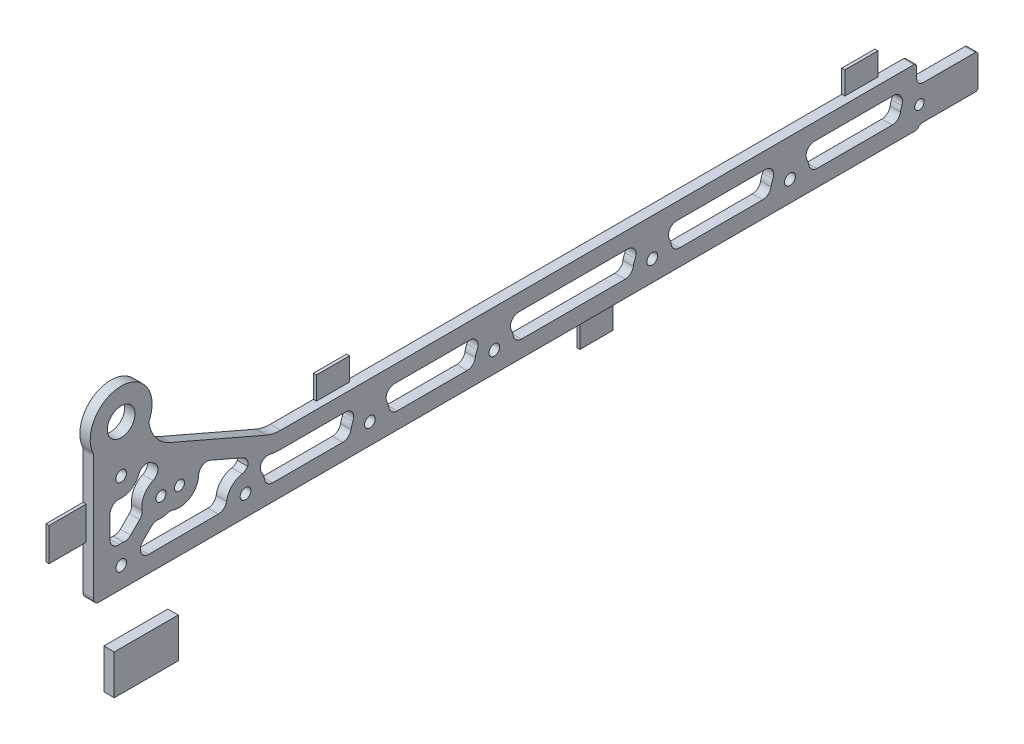
from build123d import *

# Parameters (mm, degrees)
SKETCH1_R                    = 6.35
BASE_FLANGE1_DEPTH           = 4.7625
SKETCH13_R                   = 2.286
CUT_EXTRUDE1_DEPTH           = 177.861362293
FILLET1_R                    = 16.51
F_10_0_1935_DIAMETER_HOLE1_D = 4.9149
FILLET4_R                    = 2.54
SKETCH37_R                   = 2.4892
SKETCH37_R_2                 = 2.159
BOSS_EXTRUDE8_DEPTH          = 4.7625
CUT_EXTRUDE4_DEPTH           = 385.869414133
FILLET10_R                   = 3.81
FILLET9_R                    = 1.27
SKETCH41_W                   = 15.24
SKETCH41_H                   = 10.426795597
SKETCH41_H_2                 = 13.305594342
SKETCH41_W_2                 = 17.065899381
SKETCH41_H_3                 = 15.24
BOSS_EXTRUDE9_DEPTH          = 1.397
SKETCH43_W                   = 29.412180093
SKETCH43_H                   = 18.266511847
BOSS_EXTRUDE10_DEPTH         = 4.7625


# Sheet-metal steps are written as plain solids
with BuildPart() as part:
    # Sketch1 → Base-Flange1 (new body)
    with BuildSketch(Plane(origin=(0, 0, 0), x_dir=(0, 0, -1), z_dir=(1, 0, 0))):
        with BuildLine():
            Line((0, 24.765), (57.15, 0))
            Line((57.15, 0), (168.275, 0))
            Line((168.275, 0), (168.275, -26.67))
            Line((168.275, -26.67), (-25.4, -26.67))
            Line((-25.4, -26.67), (-25.4, 24.765))
            Line((-25.4, 24.765), (-25.4, 33.599363732))
            ThreePointArc((-25.4, 33.599363732), (-12.7, 54.229), (0, 33.599363732))
            Line((0, 33.599363732), (0, 24.765))
        make_face()
        with Locations((-12.7, 40.005)):
            Circle(SKETCH1_R, mode=Mode.SUBTRACT)
    extrude(amount=-BASE_FLANGE1_DEPTH)

    # Sketch13 → Cut-Extrude1 (cut, through all)
    with BuildSketch(Plane(origin=(0, 0, 0), x_dir=(0, 0, -1), z_dir=(1, 0, 0))):
        with Locations((5.599088111, 1.280695695)):
            Circle(SKETCH13_R)
        with Locations((14.108088111, 1.280695695)):
            Circle(SKETCH13_R)
    extrude(amount=-CUT_EXTRUDE1_DEPTH, mode=Mode.SUBTRACT)

    # Fillet1
    # the kernel refuses this fillet: 16.51 mm, written as the material it adds along each edge
    with BuildSketch(Plane(origin=(0, 0, -57.15), x_dir=(0, 0.3976074376343002, 0.9175556253099242), z_dir=(-1, 0, 0))) as fillet1_piece_1:
        with BuildLine():
            CenterArc((FILLET1_R * 0.20735118835, FILLET1_R), FILLET1_R, 246.571307191, 23.428692809)
            Line((-FILLET1_R * 0.190256249285, FILLET1_R * 0.0824443746901), (-FILLET1_R * 0.198208398037, FILLET1_R * 0.0640932621839))
            Line((-FILLET1_R * 0.198208398037, FILLET1_R * 0.0640932621839), (-FILLET1_R * 0.00414702376699, -FILLET1_R * 0.02))
            Line((-FILLET1_R * 0.00414702376699, -FILLET1_R * 0.02), (FILLET1_R * 0.20735118835, -FILLET1_R * 0.02))
            Line((FILLET1_R * 0.20735118835, -FILLET1_R * 0.02), (FILLET1_R * 0.20735118835, 0))
        make_face()
    extrude(amount=4.7625)
    with BuildSketch(Plane(origin=(0, 24.765, 0), x_dir=(0, 1, 0), z_dir=(-1, 0, 0))) as fillet1_piece_2:
        with BuildLine():
            CenterArc((10.895073619, 16.380890536), FILLET1_R, 203.428692809, 59.401184998)
            Line((-4.253769754, 9.816391741), (-4.556746622, 9.685101765))
            Line((-4.556746622, 9.685101765), (-0.302976867, -0.131289976))
            Line((-0.302976867, -0.131289976), (0, -0.3302))
            ThreePointArc((0, -0.3302), (4.417181866, -0.3302), (8.793149534, -0.327617811))
            Line((8.793149534, -0.327617811), (8.834363732, 0))
        make_face()
    extrude(amount=4.7625)

    # #10 (0.1935) Diameter Hole1 (through all)
    with Locations(Plane(origin=(0, 0, 0), x_dir=(0, 0, -1), z_dir=(1, 0, 0))):
        with Locations((-12.7, -17.145), (44.45, -17.145), (101.6, -17.145), (158.75, -17.145), (-12.7, 18.415)):
            Hole(F_10_0_1935_DIAMETER_HOLE1_D / 2)

    # Fillet4
    fillet4_edges = [part.edges().sort_by_distance(p)[0] for p in [
        (-2.38125, -26.67, 25.4),
        (-2.38125, 33.599363732, 25.4),
        (-2.38125, 33.599363732, 0),
        (-2.38125, 0, -168.275),
        (-2.38125, -26.67, -168.275),
    ]]
    fillet(fillet4_edges, radius=FILLET4_R)

    # Sketch37 → Boss-Extrude8 (add, through all)
    with BuildSketch(Plane.ZY.offset(4.7625)):
        with BuildLine():
            Line((-165.735, -26.67), (-353.050492793, -26.67))
            ThreePointArc((-353.050492793, -26.67), (-354.081300886, -25.467794465), (-355.6, -25.019))
            Line((-355.6, -25.019), (-381, -25.019))
            Line((-381, -25.019), (-381, -9.271))
            Line((-381, -9.271), (-355.6, -9.271))
            ThreePointArc((-355.6, -9.271), (-353.624343653, -8.452656347), (-352.806, -6.477))
            Line((-352.806, -6.477), (-352.806, 0))
            Line((-352.806, 0), (-165.735, 0))
            ThreePointArc((-165.735, 0), (-167.531051224, -0.743948776), (-168.275, -2.54))
            Line((-168.275, -2.54), (-168.275, -24.13))
            ThreePointArc((-168.275, -24.13), (-167.531051224, -25.926051224), (-165.735, -26.67))
        make_face()
        with Locations((-231.3432, -17.145)):
            Circle(SKETCH37_R, mode=Mode.SUBTRACT)
        with Locations((-294.5892, -17.145)):
            Circle(SKETCH37_R, mode=Mode.SUBTRACT)
        with Locations((-354.076, -17.145)):
            Circle(SKETCH37_R_2, mode=Mode.SUBTRACT)
    extrude(amount=-BOSS_EXTRUDE8_DEPTH)

    # Sketch46 → Cut-Extrude4 (cut, through all)
    with BuildSketch(Plane(origin=(0, 0, 0), x_dir=(0, 0, -1), z_dir=(1, 0, 0))):
        with BuildLine():
            Line((2.706888413, -7.038340091), (-2.772090448, -12.555226867))
            ThreePointArc((-2.772090448, -12.555226867), (-3.586204482, -16.704089198), (-0.068741928, -19.05))
            Line((-0.068741928, -19.05), (35.851037824, -19.05))
            ThreePointArc((35.851037824, -19.05), (37.693572505, -11.495056371), (44.803210666, -8.344635364))
            Line((44.803210666, -8.344635364), (46.769714385, -3.806549857))
            Line((46.769714385, -3.806549857), (28.228490299, 4.22798058))
            ThreePointArc((28.228490299, 4.22798058), (24.692377449, 3.961758537), (22.907209027, 0.897751035))
            ThreePointArc((22.907209027, 0.897751035), (18.419825524, -6.399154303), (9.853588111, -6.431010034))
            ThreePointArc((9.853588111, -6.431010034), (6.34486152, -7.495123214), (2.706888413, -7.038340091))
        make_face()
        with BuildLine():
            ThreePointArc((-17.78, -9.95022582), (-13.929881531, -8.423843716), (-9.807800302, -8.825964214))
            Line((-9.807800302, -8.825964214), (-2.699808628, -1.668793824))
            ThreePointArc((-2.699808628, -1.668793824), (-2.509818664, 4.718253902), (1.948387063, 9.295903575))
            ThreePointArc((1.948387063, 9.295903575), (4.163222782, 12.415325762), (2.552557444, 15.885491351))
            ThreePointArc((2.552557444, 15.885491351), (1.967041619, 16.308126446), (1.39443434, 16.748092478))
            ThreePointArc((1.39443434, 16.748092478), (-1.956838768, 17.442464838), (-4.513313275, 15.167025867))
            ThreePointArc((-4.513313275, 15.167025867), (-10.188589389, 9.973199703), (-17.78, 11.22022582))
            Line((-17.78, 11.22022582), (-17.78, -9.95022582))
        make_face()
        with BuildLine():
            ThreePointArc((50.629688886, -10.869442593), (52.895857664, -14.647268264), (53.048962176, -19.05))
            Line((53.048962176, -19.05), (93.001037824, -19.05))
            ThreePointArc((93.001037824, -19.05), (92.862397499, -16.037986881), (93.747815722, -13.155717162))
            ThreePointArc((93.747815722, -13.155717162), (93.59844242, -9.437373892), (90.351052516, -7.62))
            Line((90.351052516, -7.62), (60.57336812, -7.62))
            ThreePointArc((60.57336812, -7.62), (56.540885431, -7.280670091), (52.621816914, -6.272224067))
            Line((52.621816914, -6.272224067), (50.629688886, -10.869442593))
        make_face()
        with BuildLine():
            ThreePointArc((109.452184278, -13.155717162), (110.337602501, -16.037986881), (110.198962176, -19.05))
            Line((110.198962176, -19.05), (150.151037824, -19.05))
            ThreePointArc((150.151037824, -19.05), (150.012397499, -16.037986881), (150.897815722, -13.155717162))
            ThreePointArc((150.897815722, -13.155717162), (150.74844242, -9.437373892), (147.501052516, -7.62))
            Line((147.501052516, -7.62), (112.848947484, -7.62))
            ThreePointArc((112.848947484, -7.62), (109.60155758, -9.437373892), (109.452184278, -13.155717162))
        make_face()
        with BuildLine():
            ThreePointArc((166.602184278, -13.155717162), (167.487602501, -16.037986881), (167.348962176, -19.05))
            Line((167.348962176, -19.05), (222.744237824, -19.05))
            ThreePointArc((222.744237824, -19.05), (222.605597499, -16.037986881), (223.491015722, -13.155717162))
            ThreePointArc((223.491015722, -13.155717162), (223.34164242, -9.437373892), (220.094252516, -7.62))
            Line((220.094252516, -7.62), (169.998947484, -7.62))
            ThreePointArc((169.998947484, -7.62), (166.75155758, -9.437373892), (166.602184278, -13.155717162))
        make_face()
        with BuildLine():
            ThreePointArc((239.195384278, -13.155717162), (240.080802501, -16.037986881), (239.942162176, -19.05))
            Line((239.942162176, -19.05), (285.990237824, -19.05))
            ThreePointArc((285.990237824, -19.05), (285.851597499, -16.037986881), (286.737015722, -13.155717162))
            ThreePointArc((286.737015722, -13.155717162), (286.58764242, -9.437373892), (283.340252516, -7.62))
            Line((283.340252516, -7.62), (242.592147484, -7.62))
            ThreePointArc((242.592147484, -7.62), (239.34475758, -9.437373892), (239.195384278, -13.155717162))
        make_face()
        with BuildLine():
            ThreePointArc((302.441384278, -13.155717162), (303.326802501, -16.037986881), (303.188162176, -19.05))
            Line((303.188162176, -19.05), (345.477037824, -19.05))
            ThreePointArc((345.477037824, -19.05), (345.435156695, -15.440006602), (346.845143193, -12.116492733))
            ThreePointArc((346.845143193, -12.116492733), (345.786037574, -9.960896884), (345.248915661, -7.62))
            Line((345.248915661, -7.62), (305.838147484, -7.62))
            ThreePointArc((305.838147484, -7.62), (302.59075758, -9.437373892), (302.441384278, -13.155717162))
        make_face()
    extrude(amount=-CUT_EXTRUDE4_DEPTH, mode=Mode.SUBTRACT)

    # Fillet10
    # the kernel refuses this fillet: 3.81 mm, written as the material it adds along each edge
    with BuildSketch(Plane(origin=(0, -12.116492733, -346.845143193), x_dir=(0, -0.8724157215172805, 0.4887645740532785), z_dir=(-1, 0, 0))) as fillet10_piece_1:
        with BuildLine():
            CenterArc((2.074419241, 3.792099223), FILLET10_R, 217.573998525, 46.86975803)
            ThreePointArc((-0.945258943, 1.468816274), (-0.441780403, 0.754261102), (0, 0))
            ThreePointArc((0, 0), (0.852762148, 0.041380629), (1.705524296, 0))
        make_face()
    extrude(amount=4.7625)
    with BuildSketch(Plane(origin=(0, -19.05, -345.477037824), x_dir=(0, 0, 1), z_dir=(-1, 0, 0)), Plane(origin=(0, -19.05, -285.990237824), x_dir=(0, 0, 1), z_dir=(-1, 0, 0)), Plane(origin=(0, -19.05, -222.744237824), x_dir=(0, 0, 1), z_dir=(-1, 0, 0)), Plane(origin=(0, -19.05, -150.151037824), x_dir=(0, 0, 1), z_dir=(-1, 0, 0)), Plane(origin=(0, -19.05, -93.001037824), x_dir=(0, 0, 1), z_dir=(-1, 0, 0)), Plane(origin=(0, -19.05, -35.851037824), x_dir=(0, 0, 1), z_dir=(-1, 0, 0))) as fillet10_piece_2:
        with BuildLine():
            CenterArc((3.873849035, 3.81), FILLET10_R, 188.683803177, 81.316196823)
            ThreePointArc((0.107524563, 3.234760946), (0.203626087, 1.612398949), (0, 0))
            Line((0, 0), (3.873849035, 0))
        make_face()
    extrude(amount=4.7625)
    with BuildSketch(Plane(origin=(0, -19.05, -303.188162176), x_dir=(0, 0.9994479972032501, -0.033221994016196514), z_dir=(-1, 0, 0)), Plane(origin=(0, -19.05, -239.942162176), x_dir=(0, 0.9994479972032498, -0.033221994016205396), z_dir=(-1, 0, 0)), Plane(origin=(0, -19.05, -167.348962176), x_dir=(0, 0.9994479972032501, -0.033221994016196514), z_dir=(-1, 0, 0)), Plane(origin=(0, -19.05, -110.198962176), x_dir=(0, 0.99944799720325, -0.033221994016201024), z_dir=(-1, 0, 0)), Plane(origin=(0, -19.05, -53.048962176), x_dir=(0, 0.99944799720325, -0.033221994016200955), z_dir=(-1, 0, 0))) as fillet10_piece_3:
        with BuildLine():
            CenterArc((3.936593859, 3.745134862), FILLET10_R, 178.096169636, 81.316196823)
            Line((0.128696989, 3.871710659), (0, 0))
            ThreePointArc((0, 0), (1.618273765, 0.149946577), (3.236547529, 0))
        make_face()
    extrude(amount=4.7625)
    with BuildSketch(Plane(origin=(0, -10.869442593, -50.629688886), x_dir=(0, 0.9175556253099386, -0.39760743763426715), z_dir=(-1, 0, 0))) as fillet10_piece_4:
        with BuildLine():
            CenterArc((2.292344432, 3.81), FILLET10_R, 213.614229501, 56.385770499)
            ThreePointArc((-0.880561767, 1.700790136), (-0.393912819, 0.874401525), (0, 0))
            Line((0, 0), (2.292344432, 0))
        make_face()
    extrude(amount=4.7625)
    with BuildSketch(Plane(origin=(0, -6.272224067, -52.621816914), x_dir=(0, -0.9175556253098971, 0.39760743763436274), z_dir=(-1, 0, 0))) as fillet10_piece_5:
        with BuildLine():
            CenterArc((3.313125115, -3.81), FILLET10_R, 90, 78.495707646)
            ThreePointArc((-0.420331094, -3.050128473), (-0.161466919, -1.531775281), (0, 0))
            Line((0, 0), (3.313125115, 0))
        make_face()
    extrude(amount=4.7625)
    with BuildSketch(Plane(origin=(0, -7.038340091, -2.706888413), x_dir=(0, -0.2319300264876581, -0.9727324723753361), z_dir=(-1, 0, 0)), Plane(origin=(0, -8.825964214, 9.807800302), x_dir=(0, 0.2319300264876563, 0.9727324723753366), z_dir=(-1, 0, 0))) as fillet10_piece_6:
        with BuildLine():
            CenterArc((2.150170588, 3.790764614), FILLET10_R, 211.391748162, 52.848437611)
            Line((-1.102143806, 1.806186301), (0, 0))
            ThreePointArc((0, 0), (0.883902373, 0.0444658), (1.767804746, 0))
        make_face()
    extrude(amount=4.7625)
    with BuildSketch(Plane(origin=(0, -6.431010034, -9.853588111), x_dir=(0, -0.41144372990401606, 0.91143516342232), z_dir=(-1, 0, 0))) as fillet10_piece_7:
        with BuildLine():
            CenterArc((1.714410244, -3.79778246), FILLET10_R, 94.589687826, 39.411744292)
            ThreePointArc((-0.932306651, -1.057163975), (-0.444970924, -0.547262622), (0, 0))
            ThreePointArc((0, 0), (0.704767934, -0.02824288), (1.409535867, 0))
        make_face()
    extrude(amount=4.7625)
    with BuildSketch(Plane(origin=(0, -3.806549857, -46.769714385), x_dir=(0, -0.9175556253099236, 0.39760743763430156), z_dir=(-1, 0, 0))) as fillet10_piece_8:
        with BuildLine():
            CenterArc((FILLET10_R, FILLET10_R), FILLET10_R, 180, 90)
            Line((0, FILLET10_R), (0, 0))
            Line((0, 0), (FILLET10_R, 0))
        make_face()
    extrude(amount=4.7625)
    with BuildSketch(Plane(origin=(0, -8.344635364, -44.803210666), x_dir=(0, -0.06877405364112607, 0.997632261680509), z_dir=(-1, 0, 0))) as fillet10_piece_9:
        with BuildLine():
            CenterArc((2.329473589, 3.78741281), FILLET10_R, 207.372268766, 56.385770499)
            Line((-1.053951262, 2.035689007), (0, 0))
            ThreePointArc((0, 0), (0.957611105, 0.052214054), (1.91522221, 0))
        make_face()
    extrude(amount=4.7625)
    with BuildSketch(Plane(origin=(0, -1.668793824, 2.699808628), x_dir=(0, -0.7095402940325821, 0.7046648644172324), z_dir=(-1, 0, 0))) as fillet10_piece_10:
        with BuildLine():
            CenterArc((2.115899317, 3.81), FILLET10_R, 217.151562389, 52.848437611)
            ThreePointArc((-0.920825974, 1.509043785), (-0.422455832, 0.777683536), (0, 0))
            Line((0, 0), (2.115899317, 0))
        make_face()
    extrude(amount=4.7625)
    with BuildSketch(Plane(origin=(0, -9.95022582, 17.78), x_dir=(0, 1, 0), z_dir=(-1, 0, 0))) as fillet10_piece_11:
        with BuildLine():
            CenterArc((5.358597658, 3.81), FILLET10_R, 174.223153513, 95.776846487)
            ThreePointArc((1.567946876, 4.193492703), (1.054877862, 1.99545519), (0, 0))
            Line((0, 0), (5.358597658, 0))
        make_face()
    extrude(amount=4.7625)
    with BuildSketch(Plane(origin=(0, 11.22022582, 17.78), x_dir=(0, -1, 0), z_dir=(-1, 0, 0))) as fillet10_piece_12:
        with BuildLine():
            CenterArc((5.358597658, -3.81), FILLET10_R, 90, 95.776846487)
            ThreePointArc((1.567946876, -4.193492703), (1.054877862, -1.99545519), (0, 0))
            Line((0, 0), (5.358597658, 0))
        make_face()
    extrude(amount=4.7625)
    with BuildSketch(Plane(origin=(0, -7.62, -345.248915661), x_dir=(0, -0.9730192637760864, -0.23072388762467294), z_dir=(-1, 0, 0))) as fillet10_piece_13:
        with BuildLine():
            CenterArc((3.019021852, 3.781288488), FILLET10_R, 193.339693773, 69.621868313)
            Line((-0.688181543, 2.902230476), (0, 0))
            ThreePointArc((0, 0), (1.276081401, 0.078478133), (2.552162803, 0))
        make_face()
    extrude(amount=4.7625)

    # Fillet9
    fillet9_edges = [part.edges().sort_by_distance(p)[0] for p in [
        (-2.38125, -26.67, -353.050492793),
        (-2.38125, -25.019, -381),
        (-2.38125, -9.271, -381),
        (-2.38125, 0, -352.806),
    ]]
    fillet(fillet9_edges, radius=FILLET9_R)

    # Sketch41 → Boss-Extrude9 (add)
    with BuildSketch(Plane.ZY.offset(4.7625)):
        with Locations((-330.765295605, 5.213397798)):
            Rectangle(SKETCH41_W, SKETCH41_H)
        with Locations((-209.083786165, -33.322797171)):
            Rectangle(SKETCH41_W, SKETCH41_H_2)
        with Locations((-87.998754713, 5.213397798)):
            Rectangle(SKETCH41_W, SKETCH41_H)
        with Locations((33.932949691, 4.327801886)):
            Rectangle(SKETCH41_W_2, SKETCH41_H_3)
    extrude(amount=-BOSS_EXTRUDE9_DEPTH)


with BuildPart() as body_2:
    # Sketch43 → Boss-Extrude10 (new, through all)
    with BuildSketch(Plane(origin=(0, 0, 0), x_dir=(0, 0, -1), z_dir=(1, 0, 0))):
        with Locations((-1.168793283, -59.112306645)):
            Rectangle(SKETCH43_W, SKETCH43_H)
    extrude(amount=-BOSS_EXTRUDE10_DEPTH)


solid = Compound([part.part, body_2.part])
